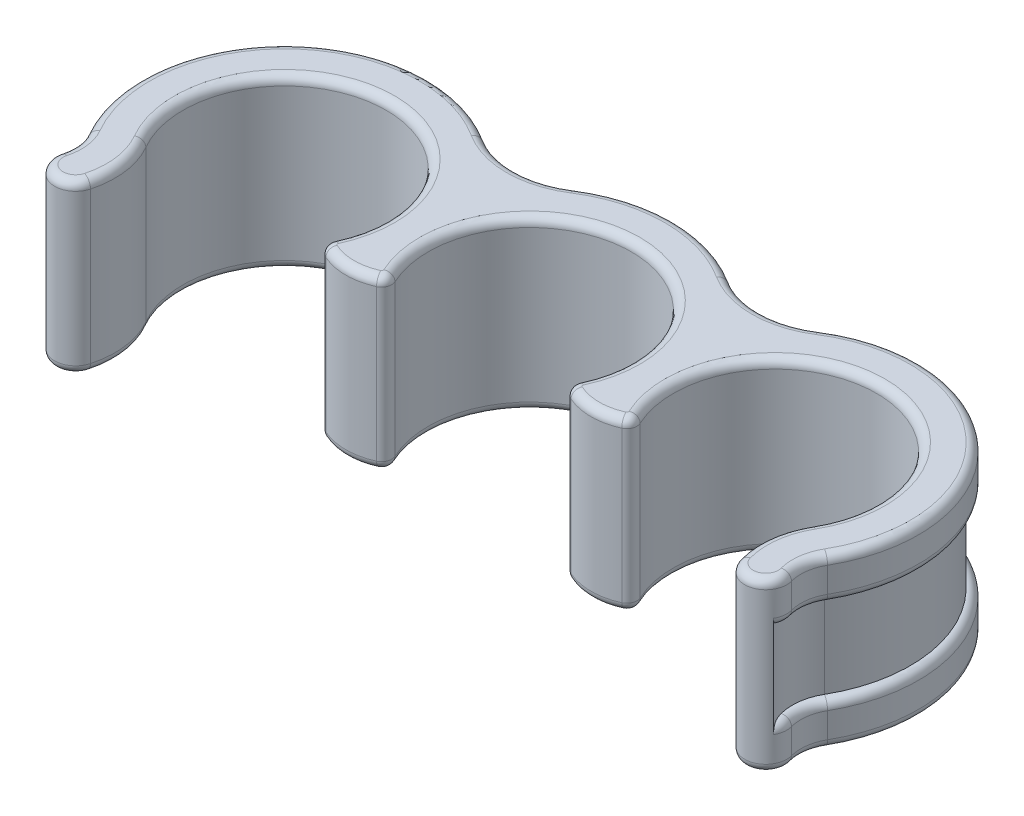
from build123d import *

# Parameters (mm, degrees)
BOSS_EXTRUDE1_DEPTH = 6.35
FILLET1_R           = 0.635
CUT_EXTRUDE1_DEPTH  = 3.175
FILLET2_R           = 0.635


with BuildPart() as part:
    # Sketch1 → Boss-Extrude1 (new, symmetric)
    with BuildSketch(Plane(origin=(0, 0, 0), x_dir=(1, 0, 0), z_dir=(0, 1, 0))):
        with BuildLine():
            ThreePointArc((15.92510619, -3.84175), (9.620682646, 7.675538697), (2.295137962, -3.220795101))
            ThreePointArc((2.295137962, -3.220795101), (2.31740567, -3.806147519), (1.917680508, -4.23434502))
            ThreePointArc((1.917680508, -4.23434502), (0, -4.648351996), (-1.917680508, -4.23434502))
            ThreePointArc((-1.917680508, -4.23434502), (-2.31740567, -3.806147519), (-2.295137962, -3.220795101))
            ThreePointArc((-2.295137962, -3.220795101), (-7.622191903, 7.504505587), (-16.9545, 0))
            ThreePointArc((-16.9545, 0), (-16.775505587, -1.648808097), (-16.246862038, -3.220795101))
            ThreePointArc((-16.246862038, -3.220795101), (-16.22459433, -3.806147519), (-16.624319492, -4.23434502))
            ThreePointArc((-16.624319492, -4.23434502), (-18.542, -4.648351996), (-20.459680508, -4.23434502))
            ThreePointArc((-20.459680508, -4.23434502), (-20.85940567, -3.806147519), (-20.837137962, -3.220795101))
            ThreePointArc((-20.837137962, -3.220795101), (-28.162682646, 7.675538697), (-34.46710619, -3.84175))
            ThreePointArc((-34.46710619, -3.84175), (-33.670692634, -6.187908679), (-33.832738507, -8.660250936))
            ThreePointArc((-33.832738507, -8.660250936), (-35.77702099, -9.782782952), (-36.899553006, -7.838500468))
            ThreePointArc((-36.899553006, -7.838500468), (-36.818530069, -6.60232934), (-37.216736847, -5.42925))
            ThreePointArc((-37.216736847, -5.42925), (-35.315064991, 7.850225673), (-21.96303321, 9.147945715))
            ThreePointArc((-21.96303321, 9.147945715), (-18.542, 8.147621572), (-15.12096679, 9.147945715))
            ThreePointArc((-15.12096679, 9.147945715), (-9.271, 10.8585), (-3.42103321, 9.147945715))
            ThreePointArc((-3.42103321, 9.147945715), (0, 8.147621572), (3.42103321, 9.147945715))
            ThreePointArc((3.42103321, 9.147945715), (16.773064991, 7.850225673), (18.674736847, -5.42925))
            ThreePointArc((18.674736847, -5.42925), (18.276530069, -6.60232934), (18.357553006, -7.838500468))
            ThreePointArc((18.357553006, -7.838500468), (17.23502099, -9.782782952), (15.290738507, -8.660250936))
            ThreePointArc((15.290738507, -8.660250936), (15.128692634, -6.187908679), (15.92510619, -3.84175))
        make_face()
    extrude(amount=BOSS_EXTRUDE1_DEPTH, both=True)

    # Fillet1
    fillet1_edges = [part.edges().sort_by_distance(p)[0] for p in [
        (15.128692634, 6.35, 6.187908679),
        (17.23502099, 6.35, 9.782782952),
        (0, -6.35, 4.648351996),
        (-2.31740567, -6.35, 3.806147519),
        (18.276530069, 6.35, 6.60232934),
        (-9.271, -6.35, -7.6835),
        (-16.22459433, -6.35, 3.806147519),
        (-18.542, -6.35, 4.648351996),
        (-20.85940567, -6.35, 3.806147519),
        (-28.162682646, -6.35, -7.675538697),
        (-33.670692634, -6.35, 6.187908679),
        (-35.77702099, -6.35, 9.782782952),
        (-36.818530069, -6.35, 6.60232934),
        (-35.315064991, -6.35, -7.850225673),
        (16.773064991, 6.35, -7.850225673),
        (-18.542, -6.35, -8.147621572),
        (-9.271, -6.35, -10.8585),
        (0, -6.35, -8.147621572),
        (16.773064991, -6.35, -7.850225673),
        (18.276530069, -6.35, 6.60232934),
        (17.23502099, -6.35, 9.782782952),
        (15.128692634, -6.35, 6.187908679),
        (9.620682646, -6.35, -7.675538697),
        (2.31740567, -6.35, 3.806147519),
        (0, 6.35, -8.147621572),
        (-9.271, 6.35, -10.8585),
        (-18.542, 6.35, -8.147621572),
        (-35.315064991, 6.35, -7.850225673),
        (-36.818530069, 6.35, 6.60232934),
        (-35.77702099, 6.35, 9.782782952),
        (2.31740567, 6.35, 3.806147519),
        (-33.670692634, 6.35, 6.187908679),
        (-28.162682646, 6.35, -7.675538697),
        (-20.85940567, 6.35, 3.806147519),
        (-18.542, 6.35, 4.648351996),
        (-16.22459433, 6.35, 3.806147519),
        (-9.271, 6.35, -7.6835),
        (-2.31740567, 6.35, 3.806147519),
        (0, 6.35, 4.648351996),
        (9.620682646, 6.35, -7.675538697),
    ]]
    fillet(fillet1_edges, radius=FILLET1_R)

    # Sketch2 → Cut-Extrude1 (cut, symmetric)
    with BuildSketch(Plane(origin=(0, 0, 0), x_dir=(1, 0, 0), z_dir=(0, 1, 0))):
        with BuildLine():
            ThreePointArc((18.124810716, -5.11175), (17.615035727, -7.088104139), (18.19846693, -9.043980989))
            ThreePointArc((18.19846693, -9.043980989), (18.397999932, -8.457075686), (18.357553006, -7.838500468))
            ThreePointArc((18.357553006, -7.838500468), (18.276530069, -6.60232934), (18.674736847, -5.42925))
            ThreePointArc((18.674736847, -5.42925), (16.773064991, 7.850225673), (3.42103321, 9.147945715))
            ThreePointArc((3.42103321, 9.147945715), (0, 8.147621572), (-3.42103321, 9.147945715))
            ThreePointArc((-3.42103321, 9.147945715), (-9.271, 10.8585), (-15.12096679, 9.147945715))
            ThreePointArc((-15.12096679, 9.147945715), (-18.542, 8.147621572), (-21.96303321, 9.147945715))
            ThreePointArc((-21.96303321, 9.147945715), (-35.315064991, 7.850225673), (-37.216736847, -5.42925))
            ThreePointArc((-37.216736847, -5.42925), (-36.818530069, -6.60232934), (-36.899553006, -7.838500468))
            ThreePointArc((-36.899553006, -7.838500468), (-36.939999932, -8.457075686), (-36.74046693, -9.043980989))
            ThreePointArc((-36.74046693, -9.043980989), (-36.157035727, -7.088104139), (-36.666810716, -5.11175))
            ThreePointArc((-36.666810716, -5.11175), (-34.87634774, 7.391148148), (-22.305136531, 8.61297813))
            ThreePointArc((-22.305136531, 8.61297813), (-18.542, 7.512621572), (-14.778863469, 8.61297813))
            ThreePointArc((-14.778863469, 8.61297813), (-9.271, 10.2235), (-3.763136531, 8.61297813))
            ThreePointArc((-3.763136531, 8.61297813), (0, 7.512621572), (3.763136531, 8.61297813))
            ThreePointArc((3.763136531, 8.61297813), (16.33434774, 7.391148148), (18.124810716, -5.11175))
        make_face()
    extrude(amount=CUT_EXTRUDE1_DEPTH, both=True, mode=Mode.SUBTRACT)

    # Fillet2
    fillet2_edges = [part.edges().sort_by_distance(p)[0] for p in [
        (0, -3.175, -8.147621572),
        (16.773064991, -3.175, -7.850225673),
        (18.276530069, -3.175, 6.60232934),
        (18.397999932, -3.175, 8.457075686),
        (-36.939999932, -3.175, 8.457075686),
        (-36.818530069, -3.175, 6.60232934),
        (-35.315064991, -3.175, -7.850225673),
        (-18.542, -3.175, -8.147621572),
        (-9.271, -3.175, -10.8585),
        (0, 3.175, -8.147621572),
        (-9.271, 3.175, -10.8585),
        (-18.542, 3.175, -8.147621572),
        (-35.315064991, 3.175, -7.850225673),
        (-36.818530069, 3.175, 6.60232934),
        (-36.939999932, 3.175, 8.457075686),
        (18.397999932, 3.175, 8.457075686),
        (18.276530069, 3.175, 6.60232934),
        (16.773064991, 3.175, -7.850225673),
    ]]
    fillet(fillet2_edges, radius=FILLET2_R - 0.0001)  # a hair under: the kernel refuses the full size


solid = part.part
